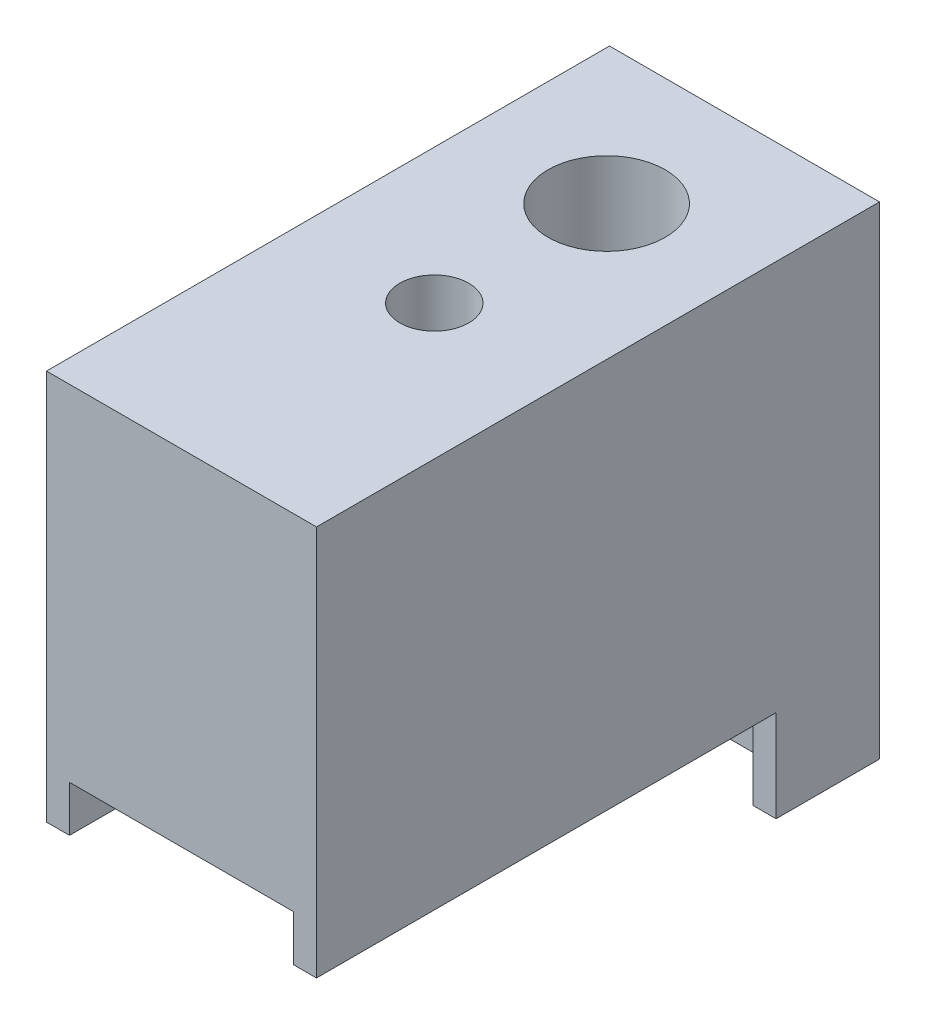
from build123d import *

# Parameters (mm, degrees)
BOSS_EXTRUDE1_DEPTH = 9.75
BOSS_EXTRUDE2_DEPTH = 2
SKETCH4_R           = 3
SKETCH4_R_2         = 5.1
CUT_EXTRUDE1_DEPTH  = 55.534965848


with BuildPart() as part:
    # Sketch2 → Boss-Extrude1 (new, symmetric)
    with BuildSketch(Plane(origin=(0, 0, 0), x_dir=(0, 0, -1), z_dir=(1, 0, 0))):
        Polygon((-44, 0), (0, 0), (0, -12), (5, -12), (5, 30), (-44, 30), align=None)
    extrude(amount=BOSS_EXTRUDE1_DEPTH, both=True)

    # Sketch3 → Boss-Extrude2 (add)
    with BuildSketch(Plane(origin=(9.75, 0, 0), x_dir=(0, 0, -1), z_dir=(1, 0, 0))):
        Polygon((-44, 30), (-44, -4), (-4, -4), (-4, -12), (5, -12), (5, 30), align=None)
    boss_extrude2 = extrude(amount=BOSS_EXTRUDE2_DEPTH)

    # Mirror1: Boss-Extrude2 across plane
    add(boss_extrude2.mirror(Plane(origin=(0, 0, 0), x_dir=(0, 0, 1), z_dir=(1, 0, 0))))

    # Sketch4 → Cut-Extrude1 (cut, through all)
    with BuildSketch(Plane.XZ):
        with Locations((0, 22)):
            Circle(SKETCH4_R)
        with Locations((0, 7)):
            Circle(SKETCH4_R_2)
    extrude(amount=-CUT_EXTRUDE1_DEPTH, mode=Mode.SUBTRACT)


solid = part.part
